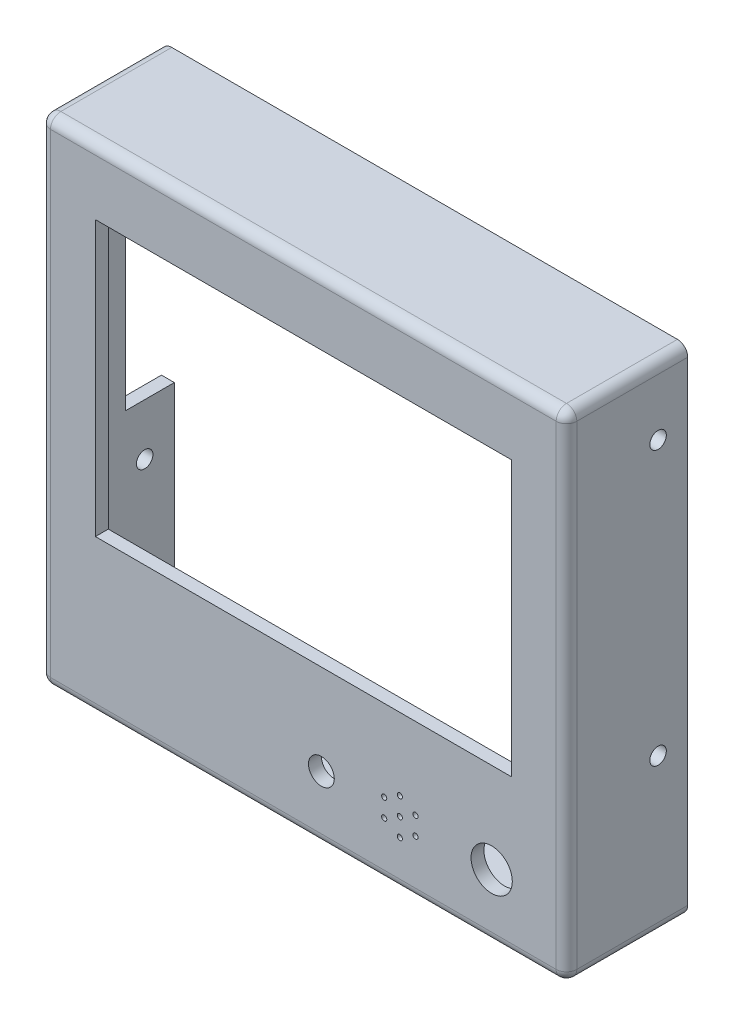
from build123d import *

# Parameters (mm, degrees)
FACE_SKETCH_W                 = 102
FACE_SKETCH_H                 = 96
FACE_SKETCH_R                 = 0.5
FACE_SKETCH_R_2               = 2.5
FACE_SKETCH_R_3               = 4
FACE_SKETCH_W_2               = 80.6
FACE_SKETCH_H_2               = 53.2
FACE_EXTRUDE_DEPTH            = 2.5
WALLS_SKETCH_W                = 102
WALLS_SKETCH_H                = 96
WALLS_SKETCH_W_2              = 97
WALLS_SKETCH_H_2              = 91
WALLS_EXTRUDE_DEPTH           = 21
SD_CARD_ACCESS_SKETCH_W       = 9.5
SD_CARD_ACCESS_SKETCH_H       = 31
SD_CARD_CUT_DEPTH             = 2.5
EDGE_RADIUS_R                 = 2
TOP_CONNECTORS_CUT_DEPTH      = 74.116345642
TOP_CONNECTORS_CUT_DEPTH_BACK = 74.116345642
TOP_CONNECTORS_SKETCH_R       = 1.6


with BuildPart() as part:
    # Face Sketch → Face Extrude (new body)
    with BuildSketch(Plane.XY):
        Rectangle(FACE_SKETCH_W, FACE_SKETCH_H)
        with Locations((18.7, -35.5)):
            Circle(FACE_SKETCH_R, mode=Mode.SUBTRACT)
        with Locations((3.5, -35.5)):
            Circle(FACE_SKETCH_R_2, mode=Mode.SUBTRACT)
        with Locations((36.5, -35.5)):
            Circle(FACE_SKETCH_R_3, mode=Mode.SUBTRACT)
        with Locations((18.7, -32)):
            Circle(FACE_SKETCH_R, mode=Mode.SUBTRACT)
        with Locations((21.731088913, -33.75)):
            Circle(FACE_SKETCH_R, mode=Mode.SUBTRACT)
        with Locations((21.731088913, -37.25)):
            Circle(FACE_SKETCH_R, mode=Mode.SUBTRACT)
        with Locations((18.7, -39)):
            Circle(FACE_SKETCH_R, mode=Mode.SUBTRACT)
        with Locations((15.668911087, -37.25)):
            Circle(FACE_SKETCH_R, mode=Mode.SUBTRACT)
        with Locations((15.668911087, -33.75)):
            Circle(FACE_SKETCH_R, mode=Mode.SUBTRACT)
        with Locations((0, 8.6)):
            Rectangle(FACE_SKETCH_W_2, FACE_SKETCH_H_2, mode=Mode.SUBTRACT)
    extrude(amount=FACE_EXTRUDE_DEPTH)

    # Walls Sketch → Walls Extrude (add)
    with BuildSketch(Plane(origin=(0, 0, 0), x_dir=(-1, 0, 0), z_dir=(0, 0, -1))):
        Rectangle(WALLS_SKETCH_W, WALLS_SKETCH_H)
        Rectangle(WALLS_SKETCH_W_2, WALLS_SKETCH_H_2, mode=Mode.SUBTRACT)
    extrude(amount=WALLS_EXTRUDE_DEPTH)

    # SD Card Access Sketch → SD Card Cut (cut)
    with BuildSketch(Plane.ZY.offset(51)):
        with Locations((-16.25, 7.5)):
            Rectangle(SD_CARD_ACCESS_SKETCH_W, SD_CARD_ACCESS_SKETCH_H)
    extrude(amount=-SD_CARD_CUT_DEPTH, mode=Mode.SUBTRACT)

    # Edge Radius
    edge_radius_edges = [part.edges().sort_by_distance(p)[0] for p in [
        (-51, 0, 2.5),
        (51, 0, 2.5),
        (0, -48, 2.5),
        (0, 48, 2.5),
        (-51, 48, -9.25),
        (51, 48, -9.25),
        (51, -48, -9.25),
        (-51, -48, -9.25),
    ]]
    fillet(edge_radius_edges, radius=EDGE_RADIUS_R)

    # Top Connectors Sketch → Top Connectors Cut (cut, two sides: drawn at the far end of the back side and taken through both)
    with BuildSketch(Plane(origin=(0, 0, 0), x_dir=(0, 0, -1), z_dir=(1, 0, 0)).offset(-TOP_CONNECTORS_CUT_DEPTH_BACK)):
        with Locations((15.25, 35)):
            Circle(TOP_CONNECTORS_SKETCH_R)
        with Locations((15.25, -18)):
            Circle(TOP_CONNECTORS_SKETCH_R)
    extrude(amount=TOP_CONNECTORS_CUT_DEPTH + TOP_CONNECTORS_CUT_DEPTH_BACK, mode=Mode.SUBTRACT)


solid = part.part
